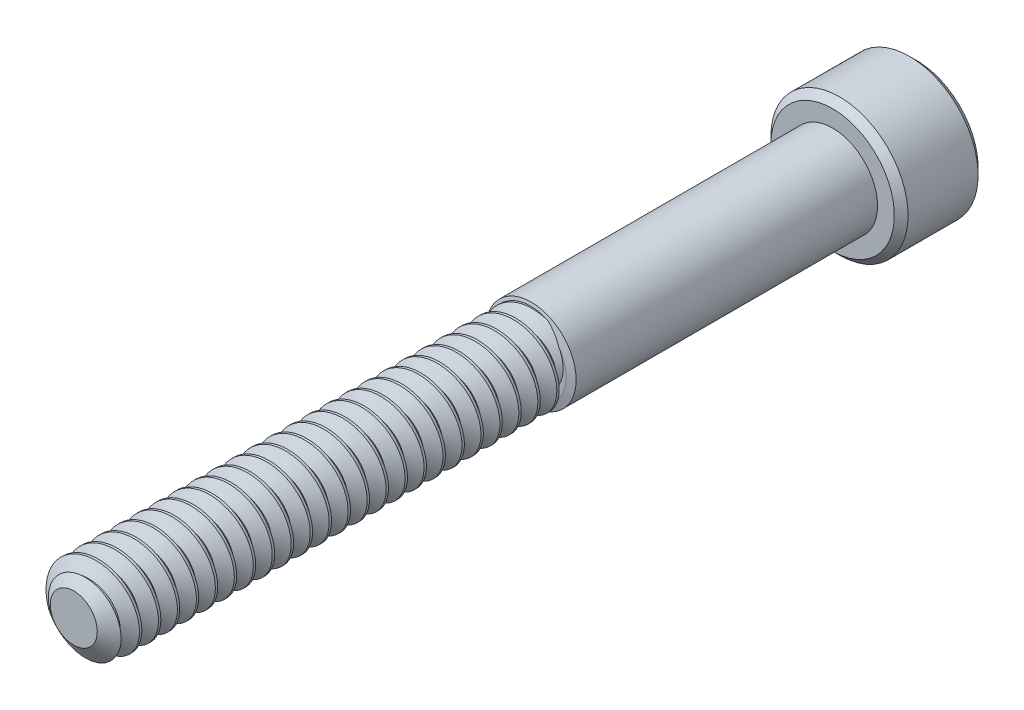
from build123d import *

# Parameters (mm, degrees)
SKETCH1_R          = 1.7526
EXTRUDE1_DEPTH     = 31.75
CUT_SWEEP1_PITCH   = 0.79375
SKETCH6_R          = 2.8702
EXTRUDE2_DEPTH     = 3.5052
CUT_EXTRUDE1_DEPTH = 2.08359375
CHAMFER1_SIZE      = 0.28702


with BuildPart() as part:
    # Sketch1 → Extrude1 (new body)
    with BuildSketch(Plane.XY):
        Circle(SKETCH1_R)
    extrude(amount=-EXTRUDE1_DEPTH)

    # Cut-Sweep1: arcs per turn and ends read off the stored shape
    # Cut-Sweep1: the profile of Sketch3 profile screwed along a right-hand helix through 43 turns, 6 arcs to a turn; built about Z, then put on its axis
    cut_sweep1_z = Axis((0, 0, 0), (0, 0, 1))
    cut_sweep1_corners = [(1.7529, 0, -1.488454455), (1.237044252, 0, -1.190625), (1.237044252, 0, -1.09140625), (1.7529, 0, -0.793576795)]
    with BuildLine(mode=Mode.PRIVATE) as cut_sweep1_profile:
        Line(cut_sweep1_corners[0], cut_sweep1_corners[1])
        Line(cut_sweep1_corners[1], cut_sweep1_corners[2])
        Line(cut_sweep1_corners[2], cut_sweep1_corners[3])
        Line(cut_sweep1_corners[3], cut_sweep1_corners[0])
    cut_sweep1_cap = Face(cut_sweep1_profile.wire())
    cut_sweep1_turn_angles = [0, 30, 60, 90, 120, 150, 180, 210, 240, 270, 300, 330, 360]
    cut_sweep1_turn_weights = [1, 0.8660254037844387, 1, 0.8660254037844387, 1, 0.8660254037844387, 1, 0.8660254037844387, 1, 0.8660254037844387, 1, 0.8660254037844387, 1]
    cut_sweep1_turn_rails = [Edge.make_bspline([Vector(p[0], p[1], 0).rotate(cut_sweep1_z, cut_sweep1_turn_angles[k]) / cut_sweep1_turn_weights[k] + Vector(0, 0, p[2] + CUT_SWEEP1_PITCH * cut_sweep1_turn_angles[k] / 360) for k in range(13)], [0, 0, 0, 1, 1, 2, 2, 3, 3, 4, 4, 5, 5, 6, 6, 6], 2, cut_sweep1_turn_weights) for p in cut_sweep1_corners]
    cut_sweep1_turn_sides = [Face.make_surface_from_curves(cut_sweep1_turn_rails[p[0]], cut_sweep1_turn_rails[p[1]]) for p in [(0, 1), (1, 2), (2, 3), (3, 0)]]
    cut_sweep1 = Plane(origin=(0, 0, 0), x_dir=(0, 1, 0), z_dir=(0, 0, -1)) * Solid(Shell([*[p.moved(Location((0, 0, CUT_SWEEP1_PITCH * i))) for i in range(43) for p in cut_sweep1_turn_sides], cut_sweep1_cap, cut_sweep1_cap.rotate(cut_sweep1_z, 15480).moved(Location((0, 0, CUT_SWEEP1_PITCH * 15480 / 360)))]))
    add(cut_sweep1, mode=Mode.SUBTRACT)

    # Sketch4 → Cut-Revolve1 (revolve, cut)
    with BuildSketch(Plane(origin=(0, 0, 0), x_dir=(0, 0, -1), z_dir=(1, 0, 0)), mode=Mode.PRIVATE) as cut_revolve1_sk:
        Polygon((0.538848736, 1.7526), (0, 0.983044252), (0, 1.7526), align=None)
    revolve(cut_revolve1_sk.sketch.rotate(Axis((0, 0, 0), (0, 0, -1)), 262.136702753), axis=Axis((0, 0, 0), (0, 0, -1)), mode=Mode.SUBTRACT)

    # Sketch5 → partially thread (revolve)
    with BuildSketch(Plane(origin=(0, 0, 0), x_dir=(0, 0, -1), z_dir=(1, 0, 0)), mode=Mode.PRIVATE) as partially_thread_sk:
        Polygon((31.75, 1.8796), (19.138476823, 1.8796), (19.05, 1.5494), (19.05, 0), (31.75, 0), align=None)
    revolve(partially_thread_sk.sketch.rotate(Axis((0, 0, 0), (0, 0, -1)), 262.136702753), axis=Axis((0, 0, 0), (0, 0, -1)))

    # Sketch6 → Extrude2 (add)
    with BuildSketch(Plane(origin=(0, 0, -31.75), x_dir=(-1, 0, 0), z_dir=(0, 0, -1))):
        Circle(SKETCH6_R)
    extrude(amount=EXTRUDE2_DEPTH)

    # Sketch7 → Cut-Extrude1 (cut)
    with BuildSketch(Plane(origin=(0, 0, -35.2552), x_dir=(-1, 0, 0), z_dir=(0, 0, -1))):
        Polygon((0, 1.603951217), (-1.3890625, 0.801975608), (-1.3890625, -0.801975608), (0, -1.603951217), (1.3890625, -0.801975608), (1.3890625, 0.801975608), align=None)
    extrude(amount=-CUT_EXTRUDE1_DEPTH, mode=Mode.SUBTRACT)

    # Cut-Extrude2 cone 1 section (through the dimple's axis) → Cut-Extrude2 (revolve, cut)
    with BuildSketch(Plane(origin=(0, 0, -35.2552), x_dir=(0, 1, 0), z_dir=(1, 0, 0))):
        Polygon((0, 0), (1.603951217, 0), (0, 1.603951217), align=None)
    revolve(axis=Axis((0, 0, -35.2552), (0, 0, 1)), mode=Mode.SUBTRACT)

    # Chamfer1
    chamfer1_edges = [part.edges().sort_by_distance(p)[0] for p in [
        (2.8702, 0, -31.75),
        (2.8702, 0, -35.2552),
    ]]
    chamfer(chamfer1_edges, length=CHAMFER1_SIZE)


solid = part.part
